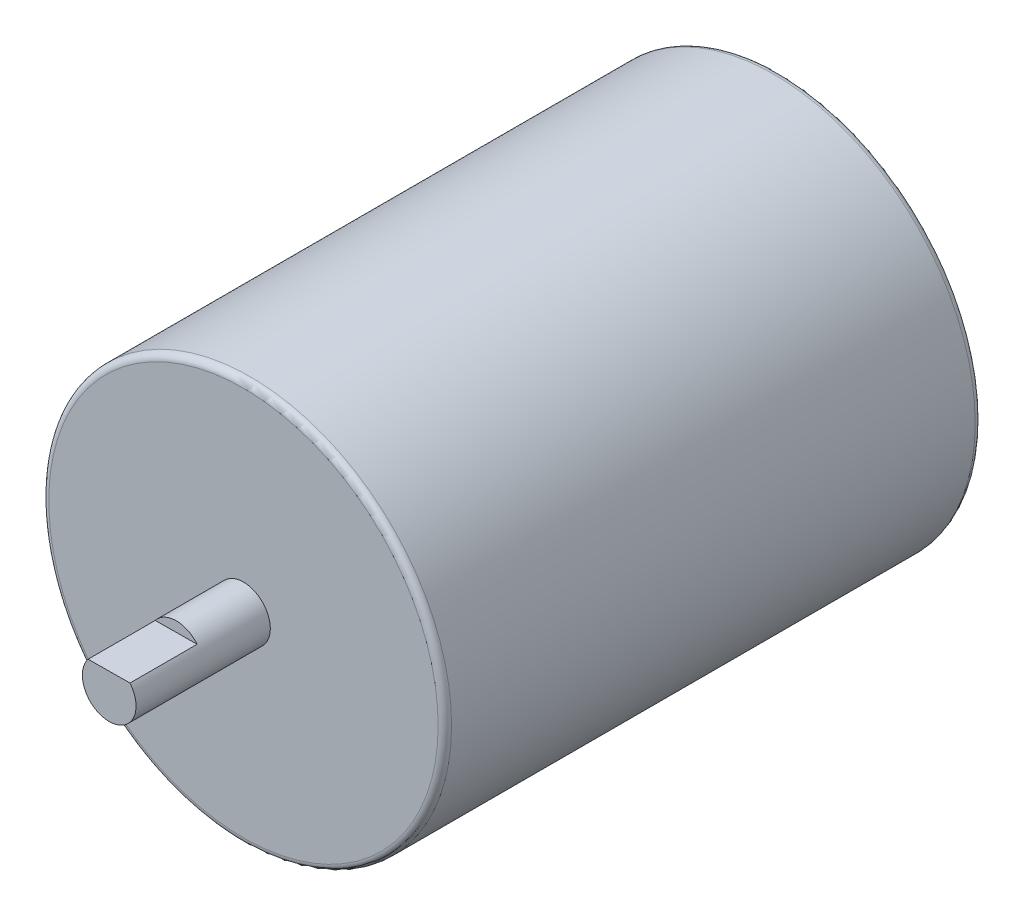
from build123d import *

# Parameters (mm, degrees)
ESQUISSE1_R             = 30
BOSS_EXTRU_1_DEPTH      = 80
ESQUISSE2_R             = 4
BOSS_EXTRU_2_DEPTH      = 20
ENL_V_START             = -10
ENL_V_MAT_EXTRU_1_DEPTH = 10
CONG_1_R                = 1


with BuildPart() as part:
    # Esquisse1 → Boss.-Extru.1 (new body)
    with BuildSketch(Plane(origin=(0, 0, 0), x_dir=(0, 1, 0), z_dir=(0, 0, 1))):
        Circle(ESQUISSE1_R)
    extrude(amount=BOSS_EXTRU_1_DEPTH)

    # Esquisse2 → Boss.-Extru.2 (add)
    with BuildSketch(Plane.XY.offset(80)):
        Circle(ESQUISSE2_R)
    extrude(amount=BOSS_EXTRU_2_DEPTH)

    # Esquisse3 → Enlèv. mat.-Extru.1 (cut)
    with BuildSketch(Plane.XY.offset(100).offset(ENL_V_START)):
        with BuildLine():
            Line((-3.142677151, 2.4745869), (3.101981411, 2.5254131))
            ThreePointArc((3.101981411, 2.5254131), (-0.032555514, 3.999867515), (-3.142677151, 2.4745869))
        make_face()
    extrude(amount=ENL_V_MAT_EXTRU_1_DEPTH, mode=Mode.SUBTRACT)

    # Congé1
    cong_1_edges = [part.edges().sort_by_distance(p)[0] for p in [
        (0, -30, 0),
        (0, -30, 80),
    ]]
    fillet(cong_1_edges, radius=CONG_1_R)


solid = part.part
